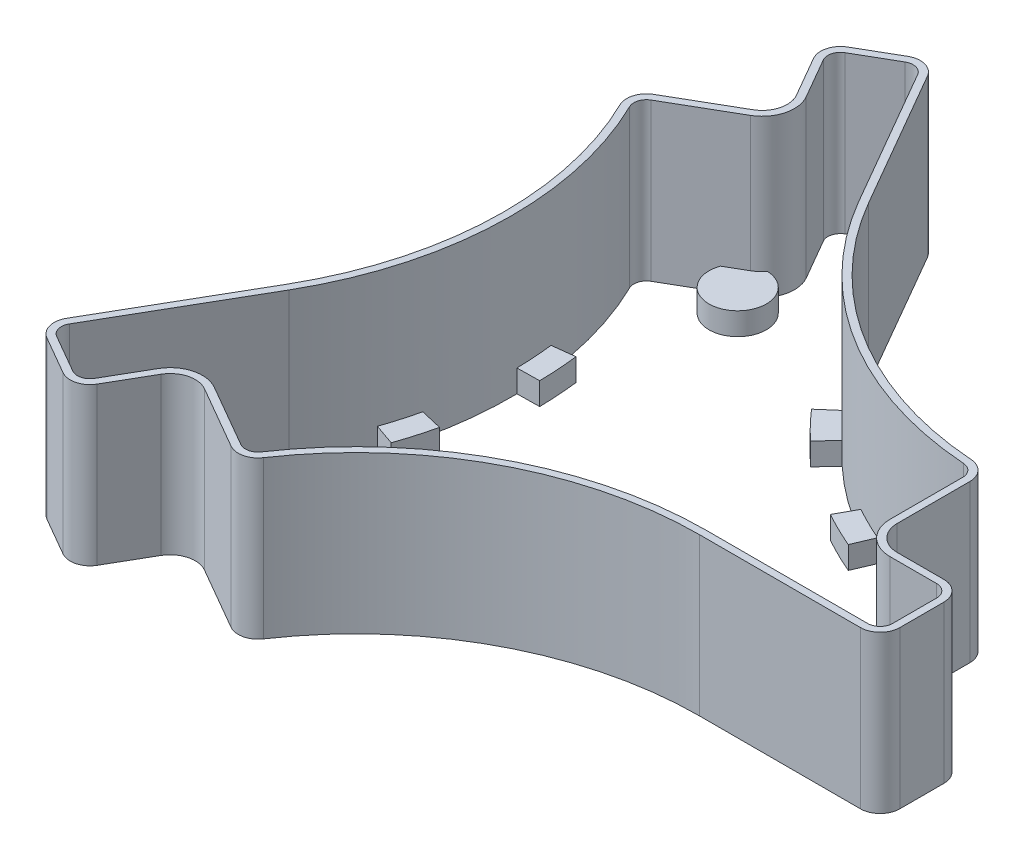
from build123d import *

# Parameters (mm, degrees)
SKETCH1_R                   = 41
BOSS_EXTRUDE1_DEPTH         = 50
FILLET2_R                   = 2
SKETCH3_R                   = 8.75
LOVIT_D17_5_THRU_DEPTH      = 623.015124039
SKETCH4_R                   = 12
LOBAC_D24X5_DEPTH           = 5
SKETCH5_R                   = 7
LOCHOT_D14_THRU_DEPTH       = 623.015124039
PATTERN_LOVIT_X3_COUNT      = 3
SKETCH6_R                   = 10
LOBAC_D20X5_DEPTH           = 5
PATTERN_LOBAC14_X3_COUNT    = 3
BOSS_EXTRUDE2_DEPTH         = 225
MATTREOVAU_D25_START        = -175
MATTREOVAU_D25_DEPTH        = 25
MATTREOVAU_GUSSET6_START    = -175
MATTREOVAU_GUSSET6_DEPTH    = 25
MATTREOVAU_GUSSET6_2_DEPTH  = 25
MATTREOVAU_GUSSET6_3_DEPTH  = 25
MATTREOVAU_GUSSET6_4_DEPTH  = 25
MATTREOVAU_GUSSET6_5_DEPTH  = 25
MATTREOTRON_X2_START        = -175
SKETCH10_R                  = 129.92
MATTREOTRON_X2_DEPTH        = 25
MATTREOTRON_X2_2_DEPTH      = 25
SK_TOOLCATKHUNG_W           = 940
SK_TOOLCATKHUNG_H           = 940
TOOL_CATCHANKHUNG_DEPTH     = 50
LOBAT_M16_X9_START          = -175
SK_LOVAU9_R                 = 7
LOBAT_M16_X9_DEPTH          = 25
LOGIUA_D150_START           = -175
SK_LOGIUA_R                 = 75
LOGIUA_D150_DEPTH           = 25
LOVIT_M20_X6_START          = -175
SKETCH12_R                  = 8.75
LOVIT_M20_X6_DEPTH          = 25
PADVIT_M12_X6_START         = -150
PADVIT_M12_X6_DEPTH         = 25
PADVIT_M12_X6_2_DEPTH       = 25
PADVIT_M12_X6_3_DEPTH       = 25
PADVIT_M12_X6_4_DEPTH       = 25
PADVIT_M12_X6_5_DEPTH       = 25
PADVIT_M12_X6_6_DEPTH       = 25
LOBU_M12_THRU_X6_START      = -175
SK_LOBU_M12_R               = 6.75
LOBU_M12_THRU_X6_DEPTH      = 25
LOBU_M12_CBORE_X6_START     = -187
SK_CBORE_M12_R              = 10
LOBU_M12_CBORE_X6_DEPTH     = 13
LOREN_M12_PAD_X6_START      = -175
SK_REN_M12_R                = 5.1
LOREN_M12_PAD_X6_DEPTH      = 20
BOSS_PADGOC_X3_START        = -175
SKETCH13_R                  = 32
BOSS_PADGOC_X3_DEPTH        = 25
BOSS_PADGOC_X3_2_DEPTH      = 25
BOSS_PADGOC_X3_3_DEPTH      = 25
LOBU_M12_THRU_GOC_X3_START  = -175
SKETCH14_R                  = 6.75
LOBU_M12_THRU_GOC_X3_DEPTH  = 12
LOBU_M12_CBORE_GOC_X3_START = -187
SKETCH15_R                  = 10
LOBU_M12_CBORE_GOC_X3_DEPTH = 13
LOREN_M12_GOC_X3_START      = -175
SKETCH16_R                  = 5.1
LOREN_M12_GOC_X3_DEPTH      = 20


with BuildPart() as part:
    # Sketch1 → Boss-Extrude1 (new body)
    with BuildSketch(Plane(origin=(0, 0, 0), x_dir=(1, 0, 0), z_dir=(0, 1, 0))):
        with BuildLine():
            Line((8.371578903, 273.5), (-81.292341855, 428.802466359))
            ThreePointArc((-81.292341855, 428.802466359), (-95.865294463, 439.98468619), (-114.076951546, 437.58707605))
            Line((-114.076951546, 437.58707605), (-156.512196331, 413.08707605))
            ThreePointArc((-156.512196331, 413.08707605), (-167.694416162, 398.514123442), (-165.296806022, 380.302466359))
            Line((-165.296806022, 380.302466359), (-139.296806022, 335.269145362))
            ThreePointArc((-139.296806022, 335.269145362), (-136.699395037, 315.53985019), (-148.813466521, 299.752484864))
            Line((-148.813466521, 299.752484864), (-218.954486267, 259.256548232))
            ThreePointArc((-218.954486267, 259.256548232), (-229.90514131, 245.491014911), (-228.527519154, 227.955082924))
            ThreePointArc((-228.527519154, 227.955082924), (-190.232761583, 47.667531746), (-241.043737387, -129.5))
            Line((-241.043737387, -129.5), (-330.707658145, -284.802466359))
            ThreePointArc((-330.707658145, -284.802466359), (-333.105268285, -303.014123442), (-321.923048454, -317.58707605))
            Line((-321.923048454, -317.58707605), (-279.487803669, -342.08707605))
            ThreePointArc((-279.487803669, -342.08707605), (-261.276146586, -344.48468619), (-246.703193978, -333.302466359))
            Line((-246.703193978, -333.302466359), (-220.703193978, -288.269145362))
            ThreePointArc((-220.703193978, -288.269145362), (-204.915828652, -276.155073879), (-185.186533479, -278.752484864))
            Line((-185.186533479, -278.752484864), (-115.045513733, -319.248421496))
            ThreePointArc((-115.045513733, -319.248421496), (-97.648884659, -321.849200291), (-83.151133157, -311.888178513))
            ThreePointArc((-83.151133157, -311.888178513), (53.835087364, -188.580170036), (232.672158483, -144))
            Line((232.672158483, -144), (412, -144))
            ThreePointArc((412, -144), (428.970562748, -136.970562748), (436, -120))
            Line((436, -120), (436, -71))
            ThreePointArc((436, -71), (428.970562748, -54.029437252), (412, -47))
            Line((412, -47), (360, -47))
            ThreePointArc((360, -47), (341.615223689, -39.384776311), (334, -21))
            Line((334, -21), (334, 59.991873264))
            ThreePointArc((334, 59.991873264), (327.554025969, 76.35818538), (311.678652311, 83.933095589))
            ThreePointArc((311.678652311, 83.933095589), (136.397674219, 140.91263829), (8.371578903, 273.5))
        make_face()
        with Locations(Location((0, 0, 0), (0, 0, 270))):
            Circle(SKETCH1_R, mode=Mode.SUBTRACT)
    extrude(amount=BOSS_EXTRUDE1_DEPTH)

    # Fillet2
    fillet2_edges = [part.edges().sort_by_distance(p)[0] for p in [
        (341.615223689, 50, 39.384776311),
        (334, 50, -19.495936632),
        (327.554025969, 50, -76.35818538),
        (-95.865294463, 50, -439.98468619),
        (-135.294573939, 50, -425.33707605),
        (-167.694416162, 50, -398.514123442),
        (-152.296806022, 50, -357.785805861),
        (327.554025969, 0, -76.35818538),
        (334, 0, -19.495936632),
        (341.615223689, 0, 39.384776311),
        (386, 0, 47),
        (428.970562748, 0, 54.029437252),
        (436, 0, 95.5),
        (428.970562748, 0, 136.970562748),
        (322.336079242, 0, 144),
        (53.835087364, 0, 188.580170036),
        (-136.699395037, 50, -315.53985019),
        (-97.648884659, 0, 321.849200291),
        (-150.116023606, 0, 299.00045318),
        (-204.915828652, 0, 276.155073879),
        (-233.703193978, 0, 310.785805861),
        (-261.276146586, 0, 344.48468619),
        (-300.705426061, 0, 329.83707605),
        (-333.105268285, 0, 303.014123442),
        (-285.875697766, 0, 207.15123318),
        (-190.232761583, 0, -47.667531746),
        (-229.90514131, 0, -245.491014911),
        (-183.883976394, 50, -279.504516548),
        (-183.883976394, 0, -279.504516548),
        (-136.699395037, 0, -315.53985019),
        (-152.296806022, 0, -357.785805861),
        (-167.694416162, 0, -398.514123442),
        (-135.294573939, 0, -425.33707605),
        (-95.865294463, 0, -439.98468619),
        (-36.460381476, 0, -351.15123318),
        (136.397674219, 0, -140.91263829),
        (-229.90514131, 50, -245.491014911),
        (-190.232761583, 50, -47.667531746),
        (-285.875697766, 50, 207.15123318),
        (-333.105268285, 50, 303.014123442),
        (136.397674219, 50, -140.91263829),
        (-300.705426061, 50, 329.83707605),
        (-261.276146586, 50, 344.48468619),
        (-233.703193978, 50, 310.785805861),
        (-204.915828652, 50, 276.155073879),
        (-150.116023606, 50, 299.00045318),
        (-97.648884659, 50, 321.849200291),
        (53.835087364, 50, 188.580170036),
        (322.336079242, 50, 144),
        (428.970562748, 50, 136.970562748),
        (436, 50, 95.5),
        (-36.460381476, 50, -351.15123318),
        (428.970562748, 50, 54.029437252),
        (386, 50, 47),
    ]]
    fillet(fillet2_edges, radius=FILLET2_R)

    # Sketch3 → LoVit-D17.5-Thru (cut, symmetric)
    with BuildSketch(Plane(origin=(0, 0, 0), x_dir=(1, 0, 0), z_dir=(0, 1, 0))):
        with Locations(Location((223, -77, 0), (0, 0, 270))):
            Circle(SKETCH3_R)
        with Locations(Location((412, -77, 0), (0, 0, 270))):
            Circle(SKETCH3_R)
        with Locations(Location((303, 25.5, 0), (0, 0, 270))):
            Circle(SKETCH3_R)
        with Locations(Location((223, 25.5, 0), (0, 0, 270))):
            Circle(SKETCH3_R)
    lovit_d17_5_thru = extrude(amount=LOVIT_D17_5_THRU_DEPTH, both=True, mode=Mode.SUBTRACT)

    # Sketch4 → LoBac-D24x5 (cut)
    with BuildSketch(Plane(origin=(0, 0, 0), x_dir=(1, 0, 0), z_dir=(0, 1, 0))):
        with Locations(Location((223, -77, 0), (0, 0, 270))):
            Circle(SKETCH4_R)
        with Locations(Location((412, -77, 0), (0, 0, 270))):
            Circle(SKETCH4_R)
        with Locations(Location((303, 25.5, 0), (0, 0, 270))):
            Circle(SKETCH4_R)
        with Locations(Location((223, 25.5, 0), (0, 0, 270))):
            Circle(SKETCH4_R)
    lobac_d24x5 = extrude(amount=LOBAC_D24X5_DEPTH, mode=Mode.SUBTRACT)

    # Sketch5 → LoChot-D14-Thru (cut, symmetric)
    with BuildSketch(Plane(origin=(0, 0, 0), x_dir=(1, 0, 0), z_dir=(0, 1, 0))):
        with Locations(Location((305, -77, 0), (0, 0, 270))):
            Circle(SKETCH5_R)
        with Locations(Location((330, -77, 0), (0, 0, 270))):
            Circle(SKETCH5_R)
    lochot_d14_thru = extrude(amount=LOCHOT_D14_THRU_DEPTH, both=True, mode=Mode.SUBTRACT)

    # Pattern-LoVit-x3: LoVit-D17.5-Thru, LoBac-D24x5, LoChot-D14-Thru ×3 about axis
    pattern_lovit_x3_axis = Axis((0, 0, 0), (0, 1, 0))
    add([lovit_d17_5_thru.rotate(pattern_lovit_x3_axis, i * 360 / PATTERN_LOVIT_X3_COUNT) for i in range(1, PATTERN_LOVIT_X3_COUNT)], mode=Mode.SUBTRACT)
    add([lobac_d24x5.rotate(pattern_lovit_x3_axis, i * 360 / PATTERN_LOVIT_X3_COUNT) for i in range(1, PATTERN_LOVIT_X3_COUNT)], mode=Mode.SUBTRACT)
    add([lochot_d14_thru.rotate(pattern_lovit_x3_axis, i * 360 / PATTERN_LOVIT_X3_COUNT) for i in range(1, PATTERN_LOVIT_X3_COUNT)], mode=Mode.SUBTRACT)

    # Sketch6 → LoBac-D20x5 (cut)
    with BuildSketch(Plane(origin=(0, 0, 0), x_dir=(1, 0, 0), z_dir=(0, 1, 0))):
        with Locations(Location((305, -77, 0), (0, 0, 270))):
            Circle(SKETCH6_R)
        with Locations(Location((330, -77, 0), (0, 0, 270))):
            Circle(SKETCH6_R)
    lobac_d20x5 = extrude(amount=LOBAC_D20X5_DEPTH, mode=Mode.SUBTRACT)

    # Pattern-LoBac14-x3: LoBac-D20x5 ×3 about axis
    pattern_lobac14_x3_axis = Axis((0, 0, 0), (0, 1, 0))
    for i in range(1, PATTERN_LOBAC14_X3_COUNT):
        add(lobac_d20x5.rotate(pattern_lobac14_x3_axis, i * 360 / PATTERN_LOBAC14_X3_COUNT), mode=Mode.SUBTRACT)


with BuildPart() as body_2:
    # Sketch7 → Boss-Extrude2 (new body)
    with BuildSketch(Plane(origin=(0, 50, 0), x_dir=(1, 0, 0), z_dir=(0, 1, 0))):
        with BuildLine():
            Line((-184.186533479, -277.020434056), (-114.045513733, -317.516370688))
            ThreePointArc((-114.045513733, -317.516370688), (-98.098603748, -319.900417917), (-84.808998205, -310.769481287))
            ThreePointArc((-84.808998205, -310.769481287), (52.896310087, -186.814186676), (232.672158483, -142))
            Line((232.672158483, -142), (412, -142))
            ThreePointArc((412, -142), (427.556349186, -135.556349186), (434, -120))
            Line((434, -120), (434, -71))
            ThreePointArc((434, -71), (427.556349186, -55.443650814), (412, -49))
            Line((412, -49), (360, -49))
            ThreePointArc((360, -49), (340.201010127, -40.798989873), (332, -21))
            Line((332, -21), (332, 59.991873264))
            ThreePointArc((332, 59.991873264), (326.091190472, 74.994326037), (311.538764618, 81.937993729))
            ThreePointArc((311.538764618, 81.937993729), (135.337676405, 139.21664164), (6.639528096, 272.5))
            Line((6.639528096, 272.5), (-83.024392663, 427.802466359))
            ThreePointArc((-83.024392663, 427.802466359), (-96.382932554, 438.052834538), (-113.076951546, 435.855025242))
            Line((-113.076951546, 435.855025242), (-155.512196331, 411.355025242))
            ThreePointArc((-155.512196331, 411.355025242), (-165.76256451, 397.996485351), (-163.564755215, 381.302466359))
            Line((-163.564755215, 381.302466359), (-137.564755215, 336.269145362))
            ThreePointArc((-137.564755215, 336.269145362), (-134.767543384, 315.0222121), (-147.813466521, 298.020434056))
            Line((-147.813466521, 298.020434056), (-217.954486267, 257.524497424))
            ThreePointArc((-217.954486267, 257.524497424), (-227.992586724, 244.90609188), (-226.729766413, 228.831487559))
            ThreePointArc((-226.729766413, 228.831487559), (-188.233986493, 47.597545036), (-239.311686579, -130.5))
            Line((-239.311686579, -130.5), (-328.975607337, -285.802466359))
            ThreePointArc((-328.975607337, -285.802466359), (-331.173416632, -302.496485351), (-320.923048454, -315.855025242))
            Line((-320.923048454, -315.855025242), (-278.487803669, -340.355025242))
            ThreePointArc((-278.487803669, -340.355025242), (-261.793784676, -342.552834538), (-248.435244785, -332.302466359))
            Line((-248.435244785, -332.302466359), (-222.435244785, -287.269145362))
            ThreePointArc((-222.435244785, -287.269145362), (-205.433466742, -274.223222226), (-184.186533479, -277.020434056))
        make_face()
        with BuildLine():
            Line((-180.186533479, -270.092230826), (-110.045513733, -310.588167458))
            ThreePointArc((-110.045513733, -310.588167458), (-99.897480106, -312.105288422), (-91.440458397, -306.294692385))
            ThreePointArc((-91.440458397, -306.294692385), (49.141200982, -179.750253239), (232.672158483, -134))
            Line((232.672158483, -134), (412, -134))
            ThreePointArc((412, -134), (421.899494937, -129.899494937), (426, -120))
            Line((426, -120), (426, -71))
            ThreePointArc((426, -71), (421.899494937, -61.100505063), (412, -57))
            Line((412, -57), (360, -57))
            ThreePointArc((360, -57), (334.544155877, -46.455844123), (324, -21))
            Line((324, -21), (324, 59.991873264))
            ThreePointArc((324, 59.991873264), (320.239848482, 69.538888665), (310.979213848, 73.957586287))
            ThreePointArc((310.979213848, 73.957586287), (131.09768515, 132.432655043), (-0.288675135, 268.5))
            Line((-0.288675135, 268.5), (-89.952595893, 423.802466359))
            ThreePointArc((-89.952595893, 423.802466359), (-98.453484914, 430.325427927), (-109.076951546, 428.926822012))
            Line((-109.076951546, 428.926822012), (-151.512196331, 404.426822012))
            ThreePointArc((-151.512196331, 404.426822012), (-158.035157899, 395.925932991), (-156.636551984, 385.302466359))
            Line((-156.636551984, 385.302466359), (-130.636551984, 340.269145362))
            ThreePointArc((-130.636551984, 340.269145362), (-127.040136774, 312.951659739), (-143.813466521, 291.092230826))
            Line((-143.813466521, 291.092230826), (-213.954486267, 250.596294194))
            ThreePointArc((-213.954486267, 250.596294194), (-220.342368376, 242.566399757), (-219.538755451, 232.337106098))
            ThreePointArc((-219.538755451, 232.337106098), (-180.238886133, 47.317598196), (-232.383483349, -134.5))
            Line((-232.383483349, -134.5), (-322.047404107, -289.802466359))
            ThreePointArc((-322.047404107, -289.802466359), (-323.446010022, -300.425932991), (-316.923048454, -308.926822012))
            Line((-316.923048454, -308.926822012), (-274.487803669, -333.426822012))
            ThreePointArc((-274.487803669, -333.426822012), (-263.864337037, -334.825427927), (-255.363448016, -328.302466359))
            Line((-255.363448016, -328.302466359), (-229.363448016, -283.269145362))
            ThreePointArc((-229.363448016, -283.269145362), (-207.504019103, -266.495815616), (-180.186533479, -270.092230826))
        make_face(mode=Mode.SUBTRACT)
    extrude(amount=-BOSS_EXTRUDE2_DEPTH)


with BuildPart() as body_3:
    # Sk-MatTreoVau → MatTreoVau-D25 (new body)
    with BuildSketch(Plane(origin=(0, 0, 0), x_dir=(1, 0, 0), z_dir=(0, 1, 0)).offset(MATTREOVAU_D25_START)):
        with BuildLine():
            Line((-114.045513733, -317.516370688), (-184.186533479, -277.020434056))
            ThreePointArc((-184.186533479, -277.020434056), (-205.433466742, -274.223222226), (-222.435244785, -287.269145362))
            Line((-222.435244785, -287.269145362), (-248.435244785, -332.302466359))
            ThreePointArc((-248.435244785, -332.302466359), (-261.793784676, -342.552834538), (-278.487803669, -340.355025242))
            Line((-278.487803669, -340.355025242), (-320.923048454, -315.855025242))
            ThreePointArc((-320.923048454, -315.855025242), (-331.173416632, -302.496485351), (-328.975607337, -285.802466359))
            Line((-328.975607337, -285.802466359), (-239.311686579, -130.5))
            ThreePointArc((-239.311686579, -130.5), (-218.0908365, -87.810397331), (-202.337273797, -42.815376315))
            ThreePointArc((-202.337273797, -42.815376315), (-206.139748433, -21.394031931), (-225.28696343, -11.0636415))
            ThreePointArc((-225.28696343, -11.0636415), (-258.528834053, 27.619593831), (-217.865133416, 58.407222981))
            ThreePointArc((-217.865133416, 58.407222981), (-196.967697859, 64.459494929), (-188.725649398, 84.594078256))
            ThreePointArc((-188.725649398, 84.594078256), (-200.638746521, 158.580604294), (-226.729766413, 228.831487559))
            ThreePointArc((-226.729766413, 228.831487559), (-227.992586724, 244.90609188), (-217.954486267, 257.524497424))
            Line((-217.954486267, 257.524497424), (-147.813466521, 298.020434056))
            ThreePointArc((-147.813466521, 298.020434056), (-134.767543384, 315.0222121), (-137.564755215, 336.269145362))
            Line((-137.564755215, 336.269145362), (-163.564755215, 381.302466359))
            ThreePointArc((-163.564755215, 381.302466359), (-165.76256451, 397.996485351), (-155.512196331, 411.355025242))
            Line((-155.512196331, 411.355025242), (-113.076951546, 435.855025242))
            ThreePointArc((-113.076951546, 435.855025242), (-96.382932554, 438.052834538), (-83.024392663, 427.802466359))
            Line((-83.024392663, 427.802466359), (6.639528096, 272.5))
            ThreePointArc((6.639528096, 272.5), (32.999383444, 232.777403407), (64.089433337, 196.636907398))
            ThreePointArc((64.089433337, 196.636907398), (84.542099075, 189.219274839), (103.062087117, 200.636054222))
            ThreePointArc((103.062087117, 200.636054222), (153.183686926, 210.082740985), (159.514705574, 159.473128647))
            ThreePointArc((159.514705574, 159.473128647), (154.307409053, 138.349282607), (167.623445478, 121.144167596))
            ThreePointArc((167.623445478, 121.144167596), (237.654205127, 94.467949324), (311.538764618, 81.937993729))
            ThreePointArc((311.538764618, 81.937993729), (326.091190472, 74.994326037), (332, 59.991873264))
            Line((332, 59.991873264), (332, -21))
            ThreePointArc((332, -21), (340.201010127, -40.798989873), (360, -49))
            Line((360, -49), (412, -49))
            ThreePointArc((412, -49), (427.556349186, -55.443650814), (434, -71))
            Line((434, -71), (434, -120))
            ThreePointArc((434, -120), (427.556349186, -135.556349186), (412, -142))
            Line((412, -142), (232.672158483, -142))
            ThreePointArc((232.672158483, -142), (185.091453055, -144.967006076), (138.24784046, -153.821531083))
            ThreePointArc((138.24784046, -153.821531083), (121.597649359, -167.825242907), (122.224876312, -189.572412722))
            ThreePointArc((122.224876312, -189.572412722), (105.345147127, -237.702334816), (58.350427842, -217.880351628))
            ThreePointArc((58.350427842, -217.880351628), (42.660288806, -202.808777536), (21.10220392, -205.738245852))
            ThreePointArc((21.10220392, -205.738245852), (-37.015458606, -253.048553618), (-84.808998205, -310.769481287))
            ThreePointArc((-84.808998205, -310.769481287), (-98.098603748, -319.900417917), (-114.045513733, -317.516370688))
        make_face()
    extrude(amount=-MATTREOVAU_D25_DEPTH)


with BuildPart() as body_4:
    # Sketch8 → MatTreoVau-Gusset6 (new body)
    with BuildSketch(Plane(origin=(0, 0, 0), x_dir=(1, 0, 0), z_dir=(0, 1, 0)).offset(MATTREOVAU_GUSSET6_START)):
        Polygon((-137.497159422, -74.963532139), (-156.055536108, 13.10227652), (-294.846276167, -31.474965139), (-282.474025043, -90.185504245), align=None)
    extrude(amount=-MATTREOVAU_GUSSET6_DEPTH)


with BuildPart() as body_5:
    # Sketch8 → MatTreoVau-Gusset6 2 (new body)
    with BuildSketch(Plane(origin=(0, 0, 0), x_dir=(1, 0, 0), z_dir=(0, 1, 0)).offset(MATTREOVAU_GUSSET6_START)):
        Polygon((-155.299997302, 20.172031082), (-118.550255868, 102.327107033), (-257.036168472, 147.842511129), (-281.535996095, 93.072460496), align=None)
    extrude(amount=-MATTREOVAU_GUSSET6_2_DEPTH)


with BuildPart() as body_6:
    # Sketch8 → MatTreoVau-Gusset6 3 (new body)
    with BuildSketch(Plane(origin=(0, 0, 0), x_dir=(1, 0, 0), z_dir=(0, 1, 0)).offset(MATTREOVAU_GUSSET6_START)):
        Polygon((3.828256521, 156.557799078), (89.374672368, 128.596920411), (120.16501869, 271.081847941), (63.134074792, 289.722433719), align=None)
    extrude(amount=-MATTREOVAU_GUSSET6_3_DEPTH)


with BuildPart() as body_7:
    # Sketch8 → MatTreoVau-Gusset6 4 (new body)
    with BuildSketch(Plane(origin=(0, 0, 0), x_dir=(1, 0, 0), z_dir=(0, 1, 0)).offset(MATTREOVAU_GUSSET6_START)):
        Polygon((95.119490014, 124.40772733), (147.89300212, 51.50397969), (256.553454634, 148.678596024), (221.371113229, 197.28109445), align=None)
    extrude(amount=-MATTREOVAU_GUSSET6_4_DEPTH)


with BuildPart() as body_8:
    # Sketch8 → MatTreoVau-Gusset6 5 (new body)
    with BuildSketch(Plane(origin=(0, 0, 0), x_dir=(1, 0, 0), z_dir=(0, 1, 0)).offset(MATTREOVAU_GUSSET6_START)):
        with BuildLine():
            Line((-29.342746252, -153.831086723), (133.668902901, -81.594266938))
            ThreePointArc((133.668902901, -81.594266938), (143.083176972, -322.885541111), (-29.342746252, -153.831086723))
        make_face()
    extrude(amount=-MATTREOVAU_GUSSET6_5_DEPTH)


with BuildPart() as body_9:
    # Sketch10 → MatTreoTron-x2 (new body)
    with BuildSketch(Plane(origin=(0, 0, 0), x_dir=(1, 0, 0), z_dir=(0, 1, 0)).offset(MATTREOTRON_X2_START)):
        with Locations(Location((131.555784912, 180.338696502, 0), (0, 0, 270))):
            Circle(SKETCH10_R)
    extrude(amount=-MATTREOTRON_X2_DEPTH)


with BuildPart() as body_10:
    # Sketch10 → MatTreoTron-x2 2 (new body)
    with BuildSketch(Plane(origin=(0, 0, 0), x_dir=(1, 0, 0), z_dir=(0, 1, 0)).offset(MATTREOTRON_X2_START)):
        with Locations(Location((-221.955784912, 23.761303498, 0), (0, 0, 270))):
            Circle(SKETCH10_R)
    extrude(amount=-MATTREOTRON_X2_2_DEPTH)


with BuildPart() as body_3_1:
    add(body_3.part)

    # GopKhoi-MatTreo: union body 8, body 10, body 5, body 6, body 4, body 9, body 7
    add(body_8.part)
    add(body_10.part)
    add(body_5.part)
    add(body_6.part)
    add(body_4.part)
    add(body_9.part)
    add(body_7.part)

    # Sk-LoVau9 → LoBat-M16-x9 (cut)
    with BuildSketch(Plane(origin=(0, 0, 0), x_dir=(1, 0, 0), z_dir=(0, 1, 0)).offset(LOBAT_M16_X9_START)):
        with Locations(Location((412, -71, 0), (0, 0, 270))):
            Circle(SK_LOVAU9_R)
        with Locations(Location((412, -120, 0), (0, 0, 270))):
            Circle(SK_LOVAU9_R)
        with Locations(Location((-102.077, 416.802, 0), (0, 0, 270))):
            Circle(SK_LOVAU9_R)
        with Locations(Location((-144.512, 392.302, 0), (0, 0, 270))):
            Circle(SK_LOVAU9_R)
        with Locations(Location((-267.488, -321.302, 0), (0, 0, 270))):
            Circle(SK_LOVAU9_R)
        with Locations(Location((-309.923, -296.802, 0), (0, 0, 270))):
            Circle(SK_LOVAU9_R)
        with Locations(Location((-206.954, 238.472, 0), (0, 0, 270))):
            Circle(SK_LOVAU9_R)
        with Locations(Location((310, 59.992, 0), (0, 0, 270))):
            Circle(SK_LOVAU9_R)
        with Locations(Location((-103.046, -298.464, 0), (0, 0, 270))):
            Circle(SK_LOVAU9_R)
    extrude(amount=-LOBAT_M16_X9_DEPTH, mode=Mode.SUBTRACT)

    # Sk-LoGiua → LoGiua-D150 (cut)
    with BuildSketch(Plane(origin=(0, 0, 0), x_dir=(1, 0, 0), z_dir=(0, 1, 0)).offset(LOGIUA_D150_START)):
        with Locations(Location((0, 0, 0), (0, 0, 270))):
            Circle(SK_LOGIUA_R)
    extrude(amount=-LOGIUA_D150_DEPTH, mode=Mode.SUBTRACT)

    # Sketch12 → LoVit-M20-x6 (cut)
    with BuildSketch(Plane(origin=(0, 0, 0), x_dir=(1, 0, 0), z_dir=(0, 1, 0)).offset(LOVIT_M20_X6_START)):
        with Locations(Location((173.636464422, -193.52100202, 0), (0, 0, 270))):
            Circle(SKETCH12_R)
        with Locations(Location((26.726059565, -258.62273245, 0), (0, 0, 270))):
            Circle(SKETCH12_R)
        with Locations(Location((80.775871704, 247.134090223, 0), (0, 0, 270))):
            Circle(SKETCH12_R)
        with Locations(Location((210.610826516, 152.456812751, 0), (0, 0, 270))):
            Circle(SKETCH12_R)
        with Locations(Location((-254.412336126, -53.613088203, 0), (0, 0, 270))):
            Circle(SKETCH12_R)
        with Locations(Location((-237.336886081, 106.165919699, 0), (0, 0, 270))):
            Circle(SKETCH12_R)
    extrude(amount=-LOVIT_M20_X6_DEPTH, mode=Mode.SUBTRACT)

    # Sk-LoBu-M12 → LoBu-M12-Thru-x6 (cut)
    with BuildSketch(Plane(origin=(0, 0, 0), x_dir=(1, 0, 0), z_dir=(0, 1, 0)).offset(LOBU_M12_THRU_X6_START)):
        with Locations(Location((7.886992904, -190.512930413, 0), (0, 0, 270))):
            Circle(SK_LOBU_M12_R)
        with Locations(Location((135.844382435, -133.804652657, 0), (0, 0, 270))):
            Circle(SK_LOBU_M12_R)
        with Locations(Location((161.04705128, 102.088745556, 0), (0, 0, 270))):
            Circle(SK_LOBU_M12_R)
        with Locations(Location((47.957582181, 184.54900435, 0), (0, 0, 270))):
            Circle(SK_LOBU_M12_R)
        with Locations(Location((-168.934294158, 88.425684784, 0), (0, 0, 270))):
            Circle(SK_LOBU_M12_R)
        with Locations(Location((-183.801686509, -50.742856727, 0), (0, 0, 270))):
            Circle(SK_LOBU_M12_R)
    extrude(amount=-LOBU_M12_THRU_X6_DEPTH, mode=Mode.SUBTRACT)

    # Sk-CBore-M12 → LoBu-M12-CBore-x6 (cut)
    with BuildSketch(Plane(origin=(0, 0, 0), x_dir=(1, 0, 0), z_dir=(0, 1, 0)).offset(LOBU_M12_CBORE_X6_START)):
        with Locations(Location((7.886992904, -190.512930413, 0), (0, 0, 270))):
            Circle(SK_CBORE_M12_R)
        with Locations(Location((135.844382435, -133.804652657, 0), (0, 0, 270))):
            Circle(SK_CBORE_M12_R)
        with Locations(Location((161.04705128, 102.088745556, 0), (0, 0, 270))):
            Circle(SK_CBORE_M12_R)
        with Locations(Location((47.957582181, 184.54900435, 0), (0, 0, 270))):
            Circle(SK_CBORE_M12_R)
        with Locations(Location((-168.934294158, 88.425684784, 0), (0, 0, 270))):
            Circle(SK_CBORE_M12_R)
        with Locations(Location((-183.801686509, -50.742856727, 0), (0, 0, 270))):
            Circle(SK_CBORE_M12_R)
    extrude(amount=-LOBU_M12_CBORE_X6_DEPTH, mode=Mode.SUBTRACT)

    # Sketch14 → LoBu-M12-Thru-Goc-x3 (cut)
    with BuildSketch(Plane(origin=(0, 0, 0), x_dir=(1, 0, 0), z_dir=(0, 1, 0)).offset(LOBU_M12_THRU_GOC_X3_START)):
        with Locations(Location((299.502544984, -17.269208088, 0), (0, 0, 270))):
            Circle(SKETCH14_R)
        with Locations(Location((-164.706845399, -250.74220841, 0), (0, 0, 270))):
            Circle(SKETCH14_R)
        with Locations(Location((-134.795699585, 268.011416498, 0), (0, 0, 270))):
            Circle(SKETCH14_R)
    extrude(amount=-LOBU_M12_THRU_GOC_X3_DEPTH, mode=Mode.SUBTRACT)

    # Sketch15 → LoBu-M12-CBore-Goc-x3 (cut)
    with BuildSketch(Plane(origin=(0, 0, 0), x_dir=(1, 0, 0), z_dir=(0, 1, 0)).offset(LOBU_M12_CBORE_GOC_X3_START)):
        with Locations(Location((299.502544984, -17.269208088, 0), (0, 0, 270))):
            Circle(SKETCH15_R)
        with Locations(Location((-164.706845399, -250.74220841, 0), (0, 0, 270))):
            Circle(SKETCH15_R)
        with Locations(Location((-134.795699585, 268.011416498, 0), (0, 0, 270))):
            Circle(SKETCH15_R)
    extrude(amount=-LOBU_M12_CBORE_GOC_X3_DEPTH, mode=Mode.SUBTRACT)


with BuildPart() as body_4_2:
    # Sk-ToolCatKhung → Tool-CatChanKhung (new body)
    with BuildSketch(Plane(origin=(0, 0, 0), x_dir=(1, 0, 0), z_dir=(0, 1, 0))):
        Rectangle(SK_TOOLCATKHUNG_W, SK_TOOLCATKHUNG_H)
    extrude(amount=TOOL_CATCHANKHUNG_DEPTH)


with BuildPart() as body_2_1:
    add(body_2.part)

    # CatChanKhung: cut body 4 2
    add(body_4_2.part, mode=Mode.SUBTRACT)


with BuildPart() as body_4_3:
    # Sk-PadVit-M12 → PadVit-M12-x6 (new body)
    with BuildSketch(Plane(origin=(0, 0, 0), x_dir=(1, 0, 0), z_dir=(0, 1, 0)).offset(PADVIT_M12_X6_START)):
        with BuildLine():
            Line((33.404320909, -192.077803179), (19.024323449, -168.052490006))
            ThreePointArc((19.024323449, -168.052490006), (0.635928159, -179.723024942), (-17.116477868, -192.339940068))
            Line((-17.116477868, -192.339940068), (-0.303926473, -214.730521025))
            ThreePointArc((-0.303926473, -214.730521025), (16.253606071, -202.962821341), (33.404320909, -192.077803179))
        make_face()
    extrude(amount=-PADVIT_M12_X6_DEPTH)


with BuildPart() as body_5_2:
    # Sk-PadVit-M12 → PadVit-M12-x6 2 (new body)
    with BuildSketch(Plane(origin=(0, 0, 0), x_dir=(1, 0, 0), z_dir=(0, 1, 0)).offset(PADVIT_M12_X6_START)):
        with BuildLine():
            Line((119.864532126, -153.760284428), (111.723931352, -126.96978949))
            ThreePointArc((111.723931352, -126.96978949), (132.720975416, -121.185447904), (153.99197281, -116.507933936))
            Line((153.99197281, -116.507933936), (159.287609255, -144.002592229))
            ThreePointArc((159.287609255, -144.002592229), (139.44831361, -148.365273526), (119.864532126, -153.760284428))
        make_face()
    extrude(amount=-PADVIT_M12_X6_2_DEPTH)


with BuildPart() as body_6_2:
    # Sk-PadVit-M12 → PadVit-M12-x6 3 (new body)
    with BuildSketch(Plane(origin=(0, 0, 0), x_dir=(1, 0, 0), z_dir=(0, 1, 0)).offset(PADVIT_M12_X6_START)):
        with BuildLine():
            Line((149.643616505, 124.969841041), (136.027073366, 100.503747096))
            ThreePointArc((136.027073366, 100.503747096), (155.328246483, 90.414188961), (175.131014685, 81.348603567))
            Line((175.131014685, 81.348603567), (186.115561774, 107.103986019))
            ThreePointArc((186.115561774, 107.103986019), (167.6456722, 115.559387781), (149.643616505, 124.969841041))
        make_face()
    extrude(amount=-PADVIT_M12_X6_3_DEPTH)


with BuildPart() as body_7_2:
    # Sk-PadVit-M12 → PadVit-M12-x6 4 (new body)
    with BuildSketch(Plane(origin=(0, 0, 0), x_dir=(1, 0, 0), z_dir=(0, 1, 0)).offset(PADVIT_M12_X6_START)):
        with BuildLine():
            Line((73.229589768, 180.687853253), (54.098632328, 160.242646786))
            ThreePointArc((54.098632328, 160.242646786), (38.590729993, 175.534456103), (23.904392162, 191.616929425))
            Line((23.904392162, 191.616929425), (45.067654228, 209.950405329))
            ThreePointArc((45.067654228, 209.950405329), (58.765488551, 194.950406173), (73.229589768, 180.687853253))
        make_face()
    extrude(amount=-PADVIT_M12_X6_4_DEPTH)


with BuildPart() as body_8_2:
    # Sk-PadVit-M12 → PadVit-M12-x6 5 (new body)
    with BuildSketch(Plane(origin=(0, 0, 0), x_dir=(1, 0, 0), z_dir=(0, 1, 0)).offset(PADVIT_M12_X6_START)):
        with BuildLine():
            Line((-183.048102175, 67.109416853), (-155.051573466, 67.550302605))
            ThreePointArc((-155.051573466, 67.550302605), (-155.964432679, 89.310384293), (-158.014875534, 110.992869186))
            Line((-158.014875534, 110.992869186), (-185.811951219, 107.627964529))
            ThreePointArc((-185.811951219, 107.627964529), (-183.899518941, 87.404877658), (-183.048102175, 67.109416853))
        make_face()
    extrude(amount=-PADVIT_M12_X6_5_DEPTH)


with BuildPart() as body_9_2:
    # Sk-PadVit-M12 → PadVit-M12-x6 6 (new body)
    with BuildSketch(Plane(origin=(0, 0, 0), x_dir=(1, 0, 0), z_dir=(0, 1, 0)).offset(PADVIT_M12_X6_START)):
        with BuildLine():
            Line((-193.093929834, -26.926117461), (-165.82235776, -33.271301195))
            ThreePointArc((-165.82235776, -33.271301195), (-171.311418332, -54.347465008), (-177.895997523, -75.107469437))
            Line((-177.895997523, -75.107469437), (-204.354920767, -65.946389764))
            ThreePointArc((-204.354920767, -65.946389764), (-198.213534405, -46.583693325), (-193.093929834, -26.926117461))
        make_face()
    extrude(amount=-PADVIT_M12_X6_6_DEPTH)


with BuildPart() as body_2_2:
    add(body_2_1.part)

    # GopKhung-Pad: union body 8 2, body 9 2, body 5 2, body 6 2, body 4 3, body 7 2
    add(body_8_2.part)
    add(body_9_2.part)
    add(body_5_2.part)
    add(body_6_2.part)
    add(body_4_3.part)
    add(body_7_2.part)

    # Sk-Ren-M12 → LoRen-M12-Pad-x6 (cut)
    with BuildSketch(Plane(origin=(0, 0, 0), x_dir=(1, 0, 0), z_dir=(0, 1, 0)).offset(LOREN_M12_PAD_X6_START)):
        with Locations(Location((7.886992904, -190.512930413, 0), (0, 0, 270))):
            Circle(SK_REN_M12_R)
        with Locations(Location((135.844382435, -133.804652657, 0), (0, 0, 270))):
            Circle(SK_REN_M12_R)
        with Locations(Location((161.04705128, 102.088745556, 0), (0, 0, 270))):
            Circle(SK_REN_M12_R)
        with Locations(Location((47.957582181, 184.54900435, 0), (0, 0, 270))):
            Circle(SK_REN_M12_R)
        with Locations(Location((-168.934294158, 88.425684784, 0), (0, 0, 270))):
            Circle(SK_REN_M12_R)
        with Locations(Location((-183.801686509, -50.742856727, 0), (0, 0, 270))):
            Circle(SK_REN_M12_R)
    extrude(amount=LOREN_M12_PAD_X6_DEPTH, mode=Mode.SUBTRACT)


with BuildPart() as body_4_4:
    # Sketch13 → Boss-PadGoc-x3 (new body)
    with BuildSketch(Plane(origin=(0, 0, 0), x_dir=(1, 0, 0), z_dir=(0, 1, 0)).offset(BOSS_PADGOC_X3_START)):
        with Locations(Location((299.502544984, -17.269208088, 0), (0, 0, 270))):
            Circle(SKETCH13_R)
    extrude(amount=BOSS_PADGOC_X3_DEPTH)


with BuildPart() as body_5_3:
    # Sketch13 → Boss-PadGoc-x3 2 (new body)
    with BuildSketch(Plane(origin=(0, 0, 0), x_dir=(1, 0, 0), z_dir=(0, 1, 0)).offset(BOSS_PADGOC_X3_START)):
        with Locations(Location((-164.706845399, -250.74220841, 0), (0, 0, 270))):
            Circle(SKETCH13_R)
    extrude(amount=BOSS_PADGOC_X3_2_DEPTH)


with BuildPart() as body_6_3:
    # Sketch13 → Boss-PadGoc-x3 3 (new body)
    with BuildSketch(Plane(origin=(0, 0, 0), x_dir=(1, 0, 0), z_dir=(0, 1, 0)).offset(BOSS_PADGOC_X3_START)):
        with Locations(Location((-134.795699585, 268.011416498, 0), (0, 0, 270))):
            Circle(SKETCH13_R)
    extrude(amount=BOSS_PADGOC_X3_3_DEPTH)


with BuildPart() as body_2_3:
    add(body_2_2.part)

    # Khoi2-KhungHan: union body 6 3, body 4 4, body 5 3
    add(body_6_3.part)
    add(body_4_4.part)
    add(body_5_3.part)

    # Sketch16 → LoRen-M12-Goc-x3 (cut)
    with BuildSketch(Plane(origin=(0, 0, 0), x_dir=(1, 0, 0), z_dir=(0, 1, 0)).offset(LOREN_M12_GOC_X3_START)):
        with Locations(Location((299.502544984, -17.269208088, 0), (0, 0, 270))):
            Circle(SKETCH16_R)
        with Locations(Location((-164.706845399, -250.74220841, 0), (0, 0, 270))):
            Circle(SKETCH16_R)
        with Locations(Location((-134.795699585, 268.011416498, 0), (0, 0, 270))):
            Circle(SKETCH16_R)
    extrude(amount=LOREN_M12_GOC_X3_DEPTH, mode=Mode.SUBTRACT)


solid = body_2_3.part
